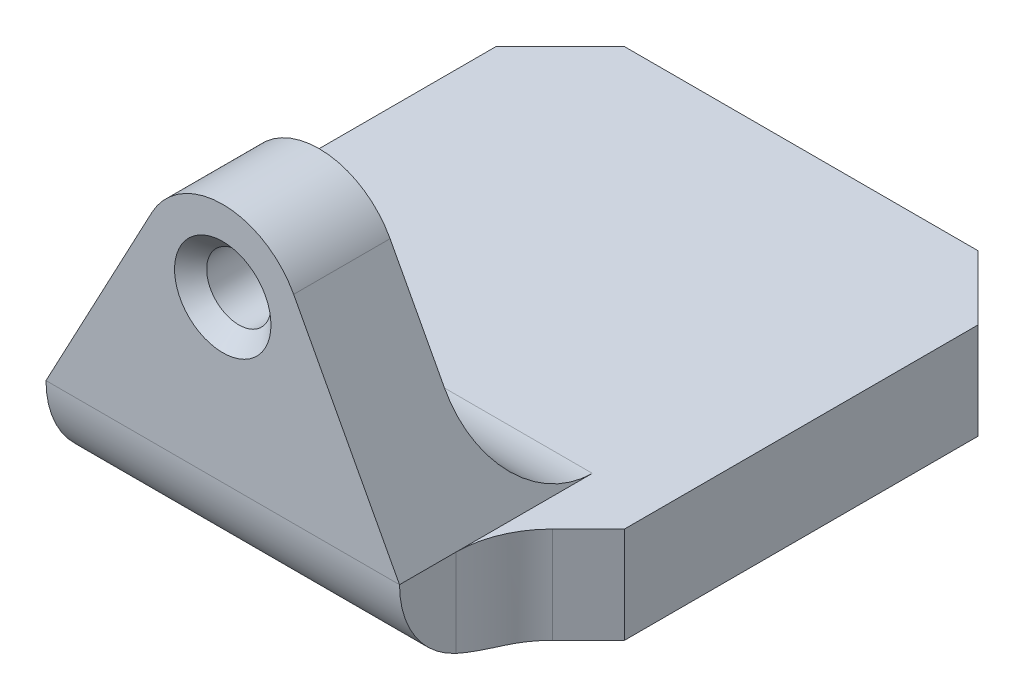
from build123d import *

# Parameters (mm, degrees)
SKETCH_1_W      = 30
SKETCH_1_H      = 30
EXTRUDE_1_DEPTH = 6
CHAMFER_1_SIZE  = 4
SKETCH_2_R      = 2
EXTRUDE_2_DEPTH = 6
FILLET_1_R      = 6
FILLET_2_R      = 6
FILLET_3_R      = 6
CHAMFER_2_SIZE  = 1


with BuildPart() as part:
    # 草图1 → 凸台-拉伸1 (new body)
    with BuildSketch(Plane(origin=(0, 0, 0), x_dir=(1, 0, 0), z_dir=(0, 1, 0))):
        Rectangle(SKETCH_1_W, SKETCH_1_H)
    extrude(amount=EXTRUDE_1_DEPTH)

    # 倒角1
    chamfer_1_edges = [part.edges().sort_by_distance(p)[0] for p in [
        (15, 3, 15),
        (-15, 3, 15),
        (-15, 3, -15),
        (15, 3, -15),
    ]]
    chamfer(chamfer_1_edges, length=CHAMFER_1_SIZE)

    # 草图2 → 凸台-拉伸2 (add)
    with BuildSketch(Plane.XY.offset(15)):
        with BuildLine():
            Line((-11, 6), (-4.411764706, 18.352941176))
            ThreePointArc((-4.411764706, 18.352941176), (0, 21), (4.411764706, 18.352941176))
            Line((4.411764706, 18.352941176), (11, 6))
            Line((11, 6), (11, 0))
            Line((11, 0), (-11, 0))
            Line((-11, 0), (-11, 6))
        make_face()
        with Locations((0, 16)):
            Circle(SKETCH_2_R, mode=Mode.SUBTRACT)
    extrude(amount=EXTRUDE_2_DEPTH)

    # 圆角1
    fillet_1_edges = [part.edges().sort_by_distance(p)[0] for p in [
        (0, 0, 21),
    ]]
    fillet(fillet_1_edges, radius=FILLET_1_R)

    # 圆角2
    # the kernel refuses this fillet: 6 mm, written as the material it adds along each edge
    with BuildSketch(Plane(origin=(-11, 0, 15), x_dir=(-0.7071067811865481, 0, -0.7071067811865467), z_dir=(0, 1, 0))) as fillet_2_piece_1_section:
        with BuildLine():
            CenterArc((FILLET_2_R * 0.414213562373, FILLET_2_R), FILLET_2_R, 225, 45)
            Line((-FILLET_2_R * 0.292893218813, FILLET_2_R * 0.292893218813), (0, 0))
            Line((0, 0), (FILLET_2_R * 0.414213562373, 0))
        make_face()
    fillet_2_piece_1 = extrude(amount=6, mode=Mode.PRIVATE)
    fillet_2_piece_1 = split(fillet_2_piece_1, bisect_by=Plane(origin=(-11.980240057, 0.038623377, 15), z_dir=(0, 0, -1)), keep=Keep.TOP, mode=Mode.PRIVATE)
    add(fillet_2_piece_1)
    with BuildSketch(Plane(origin=(-11, -6.213203436, 15), x_dir=(-0.7071067811865482, 0, -0.7071067811865468), z_dir=(0, 1, 0))) as fillet_2_piece_2_section:
        with BuildLine():
            CenterArc((FILLET_2_R * 0.414213562373, FILLET_2_R), FILLET_2_R, 225, 45)
            Line((-FILLET_2_R * 0.292893218813, FILLET_2_R * 0.292893218813), (0, 0))
            Line((0, 0), (FILLET_2_R * 0.414213562373, 0))
        make_face()
    fillet_2_piece_2 = extrude(amount=12.213203436, mode=Mode.PRIVATE)
    fillet_2_piece_2 = fillet_2_piece_2 & Plane(origin=(-11.156065336, 6, 15), x_dir=(0, -1, 0), z_dir=(-1, 0, 0)) * Cylinder(6, 35, mode=Mode.PRIVATE)
    add(fillet_2_piece_2)
    with BuildSketch(Plane(origin=(11, 0, 15), x_dir=(0.7071067811865482, 0, -0.7071067811865468), z_dir=(0, 1, 0))) as fillet_2_piece_3_section:
        with BuildLine():
            CenterArc((FILLET_2_R * 0.414213562373, -FILLET_2_R), FILLET_2_R, 90, 45)
            Line((-FILLET_2_R * 0.292893218813, -FILLET_2_R * 0.292893218813), (0, 0))
            Line((0, 0), (FILLET_2_R * 0.414213562373, 0))
        make_face()
    fillet_2_piece_3 = extrude(amount=6, mode=Mode.PRIVATE)
    fillet_2_piece_3 = split(fillet_2_piece_3, bisect_by=Plane(origin=(11.980240057, 0.038623377, 15), z_dir=(0, 0, -1)), keep=Keep.TOP, mode=Mode.PRIVATE)
    add(fillet_2_piece_3)
    with BuildSketch(Plane(origin=(11, -6.213203436, 15), x_dir=(0.7071067811865476, 0, -0.7071067811865476), z_dir=(0, 1, 0))) as fillet_2_piece_4_section:
        with BuildLine():
            CenterArc((FILLET_2_R * 0.414213562373, -FILLET_2_R), FILLET_2_R, 90, 45)
            Line((-FILLET_2_R * 0.292893218813, -FILLET_2_R * 0.292893218813), (0, 0))
            Line((0, 0), (FILLET_2_R * 0.414213562373, 0))
        make_face()
    fillet_2_piece_4 = extrude(amount=12.213203436, mode=Mode.PRIVATE)
    fillet_2_piece_4 = fillet_2_piece_4 & Plane(origin=(11.156065336, 6, 15), x_dir=(0, -1, 0), z_dir=(-1, 0, 0)) * Cylinder(6, 35, mode=Mode.PRIVATE)
    add(fillet_2_piece_4)

    # 圆角3
    fillet_3_edges = [part.edges().sort_by_distance(p)[0] for p in [
        (0, 6, 15),
    ]]
    fillet(fillet_3_edges, radius=FILLET_3_R)

    # 倒角2
    chamfer_2_edges = [part.edges().sort_by_distance(p)[0] for p in [
        (-2, 16, 15),
        (-2, 16, 21),
    ]]
    chamfer(chamfer_2_edges, length=CHAMFER_2_SIZE)


solid = part.part
